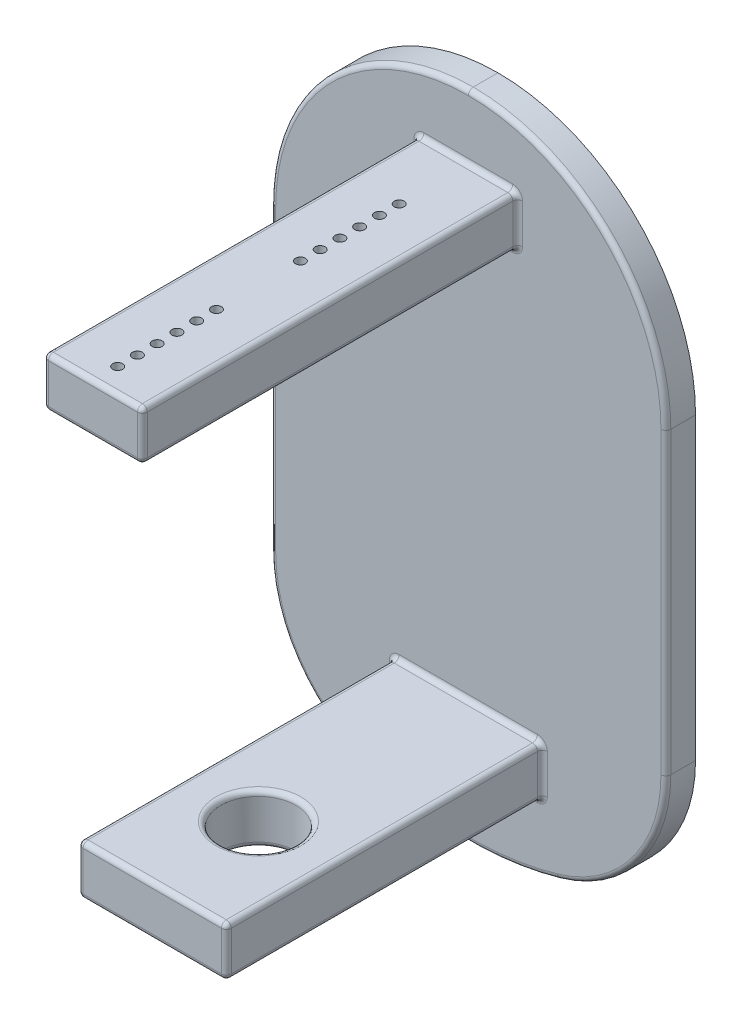
from build123d import *

# Parameters (mm, degrees)
SKETCH1_R           = 33
BOSS_EXTRUDE1_DEPTH = 3
CUT_EXTRUDE3_START  = -10
CUT_EXTRUDE3_DEPTH  = 10
FILLET2_R           = 20
FILLET3_R           = 15
SKETCH2_W           = 10
SKETCH2_H           = 5
BOSS_EXTRUDE2_DEPTH = 38
SKETCH3_R           = 0.5
CUT_EXTRUDE1_DEPTH  = 5
SKETCH4_W           = 15
SKETCH4_H           = 5
BOSS_EXTRUDE3_DEPTH = 32
SKETCH5_R           = 3.8
CUT_EXTRUDE2_DEPTH  = 28
FILLET4_R           = 0.5


with BuildPart() as part:
    # Sketch1 → Boss-Extrude1 (new body)
    with BuildSketch(Plane.XY):
        Circle(SKETCH1_R)
    extrude(amount=BOSS_EXTRUDE1_DEPTH)

    # Sketch6 → Cut-Extrude3 (cut)
    with BuildSketch(Plane.XY.offset(3).offset(CUT_EXTRUDE3_START)):
        with BuildLine():
            Line((-20, 26.248809497), (-20, -26.248809497))
            ThreePointArc((-20, -26.248809497), (-33, 0), (-20, 26.248809497))
        make_face()
        with BuildLine():
            Line((20, -26.248809497), (20, 26.248809497))
            ThreePointArc((20, 26.248809497), (33, 0), (20, -26.248809497))
        make_face()
    extrude(amount=CUT_EXTRUDE3_DEPTH, mode=Mode.SUBTRACT)

    # Fillet2
    fillet2_edges = [part.edges().sort_by_distance(p)[0] for p in [
        (-20, 26.248809497, 1.5),
        (20, 26.248809497, 1.5),
    ]]
    fillet(fillet2_edges, radius=FILLET2_R - 0.0001)  # a hair under: the kernel refuses the full size

    # Fillet3
    fillet3_edges = [part.edges().sort_by_distance(p)[0] for p in [
        (-20, -26.248809497, 1.5),
        (20, -26.248809497, 1.5),
    ]]
    fillet(fillet3_edges, radius=FILLET3_R)

    # Sketch2 → Boss-Extrude2 (add)
    with BuildSketch(Plane.XY.offset(3)):
        with Locations((0, 24)):
            Rectangle(SKETCH2_W, SKETCH2_H)
    extrude(amount=BOSS_EXTRUDE2_DEPTH)

    # Sketch3 → Cut-Extrude1 (cut)
    with BuildSketch(Plane(origin=(0, 26.5, 0), x_dir=(1, 0, 0), z_dir=(0, 1, 0))):
        with Locations(Location((0, -10, 0), (0, 0, 270))):
            Circle(SKETCH3_R)
        with Locations(Location((0, -12, 0), (0, 0, 270))):
            Circle(SKETCH3_R)
        with Locations(Location((0, -14, 0), (0, 0, 270))):
            Circle(SKETCH3_R)
        with Locations(Location((0, -16, 0), (0, 0, 270))):
            Circle(SKETCH3_R)
        with Locations(Location((0, -18, 0), (0, 0, 270))):
            Circle(SKETCH3_R)
        with Locations(Location((0, -20, 0), (0, 0, 270))):
            Circle(SKETCH3_R)
        with Locations(Location((0, -38.5, 0), (0, 0, 270))):
            Circle(SKETCH3_R)
        with Locations(Location((0, -36.5, 0), (0, 0, 270))):
            Circle(SKETCH3_R)
        with Locations(Location((0, -34.5, 0), (0, 0, 270))):
            Circle(SKETCH3_R)
        with Locations(Location((0, -32.5, 0), (0, 0, 270))):
            Circle(SKETCH3_R)
        with Locations(Location((0, -30.5, 0), (0, 0, 270))):
            Circle(SKETCH3_R)
        with Locations(Location((0, -28.5, 0), (0, 0, 270))):
            Circle(SKETCH3_R)
    extrude(amount=-CUT_EXTRUDE1_DEPTH, mode=Mode.SUBTRACT)

    # Sketch4 → Boss-Extrude3 (add)
    with BuildSketch(Plane.XY.offset(3)):
        with Locations((0, -23)):
            Rectangle(SKETCH4_W, SKETCH4_H)
    extrude(amount=BOSS_EXTRUDE3_DEPTH)

    # Sketch5 → Cut-Extrude2 (cut)
    with BuildSketch(Plane(origin=(0, -20.5, 0), x_dir=(1, 0, 0), z_dir=(0, 1, 0))):
        with Locations(Location((0, -24.25, 0), (0, 0, 270))):
            Circle(SKETCH5_R)
    extrude(amount=-CUT_EXTRUDE2_DEPTH, mode=Mode.SUBTRACT)

    # Fillet4
    fillet4_edges = [part.edges().sort_by_distance(p)[0] for p in [
        (7.5, -23, 3),
        (7.5, -25.5, 19),
        (0, -20.5, 3),
        (7.5, -20.5, 19),
        (-7.5, -23, 3),
        (-7.5, -20.5, 19),
        (0, -25.5, 3),
        (-7.5, -25.5, 19),
        (7.5, -23, 35),
        (0, -20.5, 35),
        (-7.5, -23, 35),
        (0, -25.5, 35),
        (0, -25.5, 20.45),
        (0, -20.5, 20.45),
        (20, -2.145758233, 3),
        (14.142219305, 27.14211052, 3),
        (-14.142219305, 27.14211052, 3),
        (0, -33, 3),
        (-20, -2.145758233, 3),
        (-16.989578808, -26.305494654, 3),
        (16.989578808, -26.305494654, 3),
        (5, 24, 3),
        (5, 21.5, 22),
        (0, 26.5, 3),
        (5, 26.5, 22),
        (-5, 24, 3),
        (-5, 26.5, 22),
        (0, 21.5, 3),
        (-5, 21.5, 22),
        (5, 24, 41),
        (0, 26.5, 41),
        (-5, 24, 41),
        (0, 21.5, 41),
    ]]
    fillet(fillet4_edges, radius=FILLET4_R)


solid = part.part
